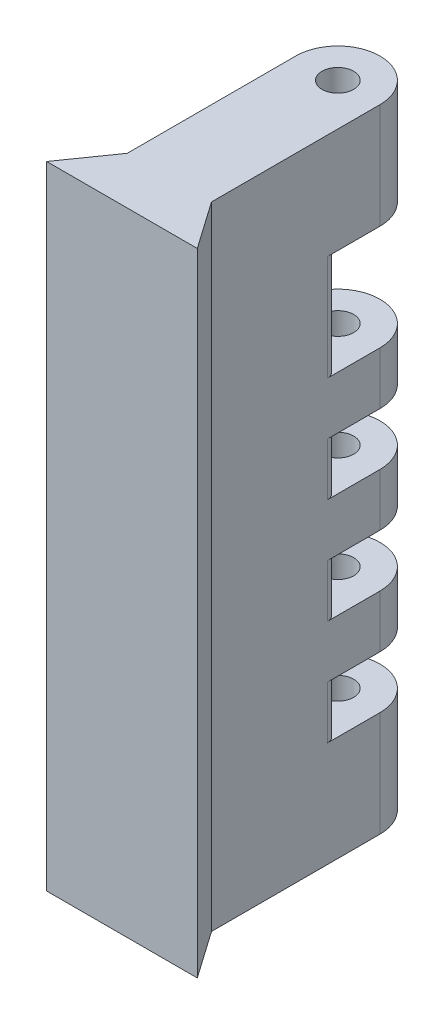
from build123d import *

# Parameters (mm, degrees)
BOSS_EXTRUDE1_DEPTH     = 60
SKETCH2_W               = 8
SKETCH2_H               = 10
BOSS_EXTRUDE3_DEPTH     = 60
SKETCH3_R               = 1.5
CUT_EXTRUDE1_DEPTH      = 60
FILLET1_R               = 4
CUT_EXTRUDE2_DEPTH      = 60
CUT_EXTRUDE2_DEPTH_BACK = 60
FILLET3_R               = 1
SKETCH5_R               = 2.607227144
BOSS_EXTRUDE4_DEPTH     = 5


with BuildPart() as part:
    # Sketch1 → Boss-Extrude1 (new body)
    with BuildSketch(Plane(origin=(0, 0, 0), x_dir=(1, 0, 0), z_dir=(0, 1, 0))):
        Polygon((4, 0), (-4, 0), (-4, -10), (-7.150933922, -14.5), (-4, -14.5), (4, -14.5), (7.150933922, -14.5), (4, -10), align=None)
    extrude(amount=BOSS_EXTRUDE1_DEPTH)

    # Sketch2 → Boss-Extrude3 (add)
    with BuildSketch(Plane(origin=(0, 0, 0), x_dir=(1, 0, 0), z_dir=(0, 1, 0))):
        with Locations((0, 5)):
            Rectangle(SKETCH2_W, SKETCH2_H)
    extrude(amount=BOSS_EXTRUDE3_DEPTH)

    # Sketch3 → Cut-Extrude1 (cut)
    with BuildSketch(Plane(origin=(0, 0, 0), x_dir=(1, 0, 0), z_dir=(0, 1, 0))):
        with Locations(Location((0, 6, 0), (0, 0, 270))):
            Circle(SKETCH3_R)
    extrude(amount=CUT_EXTRUDE1_DEPTH, mode=Mode.SUBTRACT)

    # Fillet1
    fillet1_edges = [part.edges().sort_by_distance(p)[0] for p in [
        (-4, 30, -10),
        (4, 30, -10),
    ]]
    fillet(fillet1_edges, radius=FILLET1_R - 0.0001)  # a hair under: the kernel refuses the full size

    # Sketch4 → Cut-Extrude2 (cut, two sides: drawn at the far end of the back side and taken through both)
    with BuildSketch(Plane(origin=(0, 0, 0), x_dir=(0, 0, -1), z_dir=(1, 0, 0)).offset(-CUT_EXTRUDE2_DEPTH_BACK)):
        Polygon((12.627548849, 60), (16.888144273, 60), (16.888144273, 0), (13.444072136, 0), (13.444072136, 10), (2, 10), (2, 15), (13.444072136, 15), (13.444072136, 20), (2, 20), (2, 25), (13.444072136, 25), (13.444072136, 30), (2, 30), (2, 35), (13.444072136, 35), (13.444072136, 40), (2, 40), (2, 45), (2, 50), (12.627548849, 50), align=None)
    extrude(amount=CUT_EXTRUDE2_DEPTH + CUT_EXTRUDE2_DEPTH_BACK, mode=Mode.SUBTRACT)

    # Fillet3
    fillet3_edges = [part.edges().sort_by_distance(p)[0] for p in [
        (-4, 12.5, -2),
        (4, 12.5, -2),
        (4, 22.5, -2),
        (4, 32.5, -2),
        (4, 45, -2),
        (-4, 45, -2),
        (-4, 32.5, -2),
        (-4, 22.5, -2),
    ]]
    fillet(fillet3_edges, radius=FILLET3_R)

    # Sketch5 → Boss-Extrude4 (add)
    with BuildSketch(Plane(origin=(0, 0, 0), x_dir=(1, 0, 0), z_dir=(0, 1, 0))):
        with Locations((0, 6)):
            Circle(SKETCH5_R)
    extrude(amount=BOSS_EXTRUDE4_DEPTH)


solid = part.part
